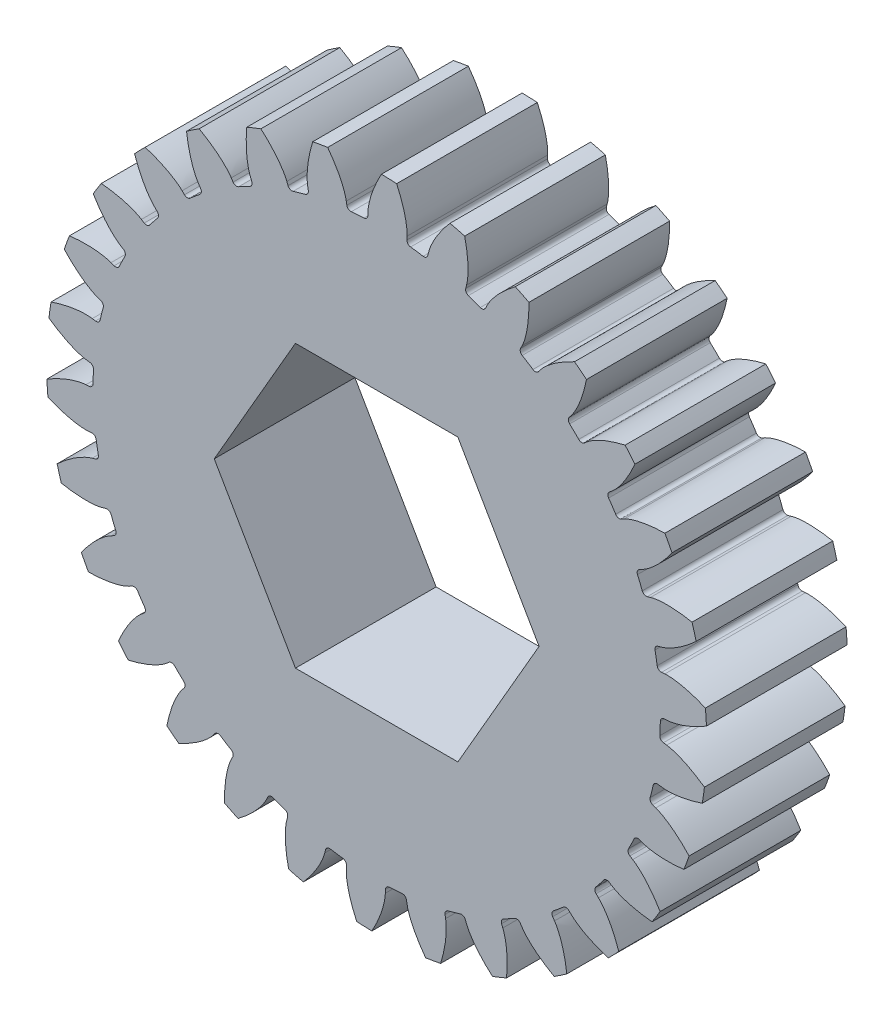
from build123d import *

# Parameters (mm, degrees)
SKETCH1_R                = 30.25
BOSS_EXTRUDE1_DEPTH      = 7.5
BOSS_EXTRUDE2_DEPTH      = 7.5
BOSS_EXTRUDE3_DEPTH      = 7.5
FILLET1_R                = 0.44
CIRPATTERN1_COUNT        = 30
FILLET1_OF_CIRPATTERN1_R = 0.44
CUT_EXTRUDE1_DEPTH       = 52.96538652


with BuildPart() as part:
    # Sketch1 → Boss-Extrude1 (new, symmetric)
    with BuildSketch(Plane.XY):
        Circle(SKETCH1_R)
    extrude(amount=BOSS_EXTRUDE1_DEPTH, both=True)

    # Sketch4 → Boss-Extrude2 (add, symmetric)
    with BuildSketch(Plane.XY):
        with BuildLine():
            ThreePointArc((29.969770044, 4.107965859), (30.181592394, 2.03321926), (30.249956685, -0.051191564))
            Line((30.249956685, -0.051191564), (31.009856486, 0))
            ThreePointArc((31.009856486, 0), (30.939730534, 2.084292147), (30.729669846, 4.159157422))
            Line((30.729669846, 4.159157422), (29.969770044, 4.107965859))
        make_face()
    boss_extrude2 = extrude(amount=BOSS_EXTRUDE2_DEPTH, both=True)

    # Sketch6 → Boss-Extrude3 (add, symmetric)
    with BuildSketch(Plane.XY):
        with BuildLine():
            ThreePointArc((30.729669846, 4.159157422), (30.939730534, 2.084292147), (31.009856486, 0))
            add(Edge.make_bspline(
                [(31.009856486, 0), (31.057646427, 0.00152442), (31.153029989, 0.00743036), (31.419459867, 0.038932409), (31.921419499, 0.137427154), (32.675495048, 0.3542441), (33.628154104, 0.730605066), (34.38993751, 1.11037961), (34.918887585, 1.409140911), (35.16558954, 1.556056662)],
                knots=[0, 0, 0, 0, 0, 0.002802036, 0.005604071, 0.015718253, 0.029959921, 0.048733673, 0.065569115, 0.065569115, 0.065569115, 0.065569115, 0.065569115], degree=4))
            ThreePointArc((35.16558954, 1.556056662), (35.120398422, 2.365927866), (35.056558278, 3.174542756))
            add(Edge.make_bspline(
                [(30.729669846, 4.159157422), (30.777232446, 4.164056541), (30.872546306, 4.170997162), (31.140794053, 4.175514314), (31.651428758, 4.145234204), (32.427771225, 4.031515707), (33.422301554, 3.786329496), (34.228138713, 3.512159596), (34.792380488, 3.287042479), (35.056558278, 3.174542756)],
                knots=[0, 0, 0, 0, 0, 0.002802036, 0.005604071, 0.015718253, 0.029959921, 0.048733673, 0.065569115, 0.065569115, 0.065569115, 0.065569115, 0.065569115], degree=4))
        make_face()
    boss_extrude3 = extrude(amount=BOSS_EXTRUDE3_DEPTH, both=True)

    # Fillet1
    fillet1_edges = [part.edges().sort_by_distance(p)[0] for p in [
        (30.249956685, -0.051191564, 0),
        (29.969770044, 4.107965859, 0),
    ]]
    fillet(fillet1_edges, radius=FILLET1_R)

    # CirPattern1: Boss-Extrude2, Boss-Extrude3 ×30 about axis
    cirpattern1_axis = Axis((0, 0, 7.5), (0, 0, -1))
    add([boss_extrude2.rotate(cirpattern1_axis, i * 360 / CIRPATTERN1_COUNT) for i in range(1, CIRPATTERN1_COUNT)])
    add([boss_extrude3.rotate(cirpattern1_axis, i * 360 / CIRPATTERN1_COUNT) for i in range(1, CIRPATTERN1_COUNT)])

    # Fillet1 of CirPattern1
    fillet1_of_cirpattern1_edges = [part.edges().sort_by_distance(p)[0] for p in [
        (29.578279229, -6.339392547, 0),
        (30.168952791, -2.212868615, 0),
        (27.613889038, -12.350531656, 0),
        (29.049607534, -8.436990111, 0),
        (24.442639391, -17.821893267, 0),
        (26.660655032, -14.292374655, 0),
        (20.203129113, -22.514352623, 0),
        (23.106503973, -19.523113843, 0),
        (15.080645148, -26.222826734, 0),
        (18.542487814, -23.900599275, 0),
        (9.299064624, -28.785237486, 0),
        (13.16807596, -27.23351383, 0),
        (3.111070355, -30.089595232, 0),
        (7.218155999, -29.37619315, 0),
        (-3.212892617, -30.078893281, 0),
        (0.952767985, -30.234991867, 0),
        (-9.396436765, -28.753599359, 0),
        (-5.354260563, -29.772376355, 0),
        (-15.169311537, -26.17163517, 0),
        (-11.427282231, -28.008565133, 0),
        (-20.279214604, -22.445844939, 0),
        (-17.000876831, -25.020645215, 0),
        (-24.502818683, -17.739063577, 0),
        (-21.831451535, -20.939203039, 0),
        (-27.655532008, -12.257000015, 0),
        (-25.707887047, -15.942617212, 0),
        (-29.599565878, -6.239246736, 0),
        (-28.460764536, -10.249262512, 0),
        (-30.249956685, 0.051191564, 0),
        (-29.969770044, -4.107965859, 0),
        (-29.578279229, 6.339392547, 0),
        (-30.168952791, 2.212868615, 0),
        (-27.613889038, 12.350531656, 0),
        (-29.049607534, 8.436990111, 0),
        (-24.442639391, 17.821893267, 0),
        (-26.660655032, 14.292374655, 0),
        (-20.203129113, 22.514352623, 0),
        (-23.106503973, 19.523113843, 0),
        (-15.080645148, 26.222826734, 0),
        (-18.542487814, 23.900599275, 0),
        (-9.299064624, 28.785237486, 0),
        (-13.16807596, 27.23351383, 0),
        (-3.111070355, 30.089595232, 0),
        (-7.218155999, 29.37619315, 0),
        (3.212892617, 30.078893281, 0),
        (-0.952767985, 30.234991867, 0),
        (9.396436765, 28.753599359, 0),
        (5.354260563, 29.772376355, 0),
        (15.169311537, 26.17163517, 0),
        (11.427282231, 28.008565133, 0),
        (20.279214604, 22.445844939, 0),
        (17.000876831, 25.020645215, 0),
        (24.502818683, 17.739063577, 0),
        (21.831451535, 20.939203039, 0),
        (27.655532008, 12.257000015, 0),
        (25.707887047, 15.942617212, 0),
        (29.599565878, 6.239246736, 0),
        (28.460764536, 10.249262512, 0),
    ]]
    fillet(fillet1_of_cirpattern1_edges, radius=FILLET1_OF_CIRPATTERN1_R)

    # Sketch7 → Cut-Extrude1 (cut, through all)
    with BuildSketch(Plane.XY.offset(7.5)):
        Polygon((8.660254038, 15), (-8.660254038, 15), (-17.320508076, 0), (-8.660254038, -15), (8.660254038, -15), (17.320508076, 0), align=None)
    extrude(amount=-CUT_EXTRUDE1_DEPTH, mode=Mode.SUBTRACT)


solid = part.part
